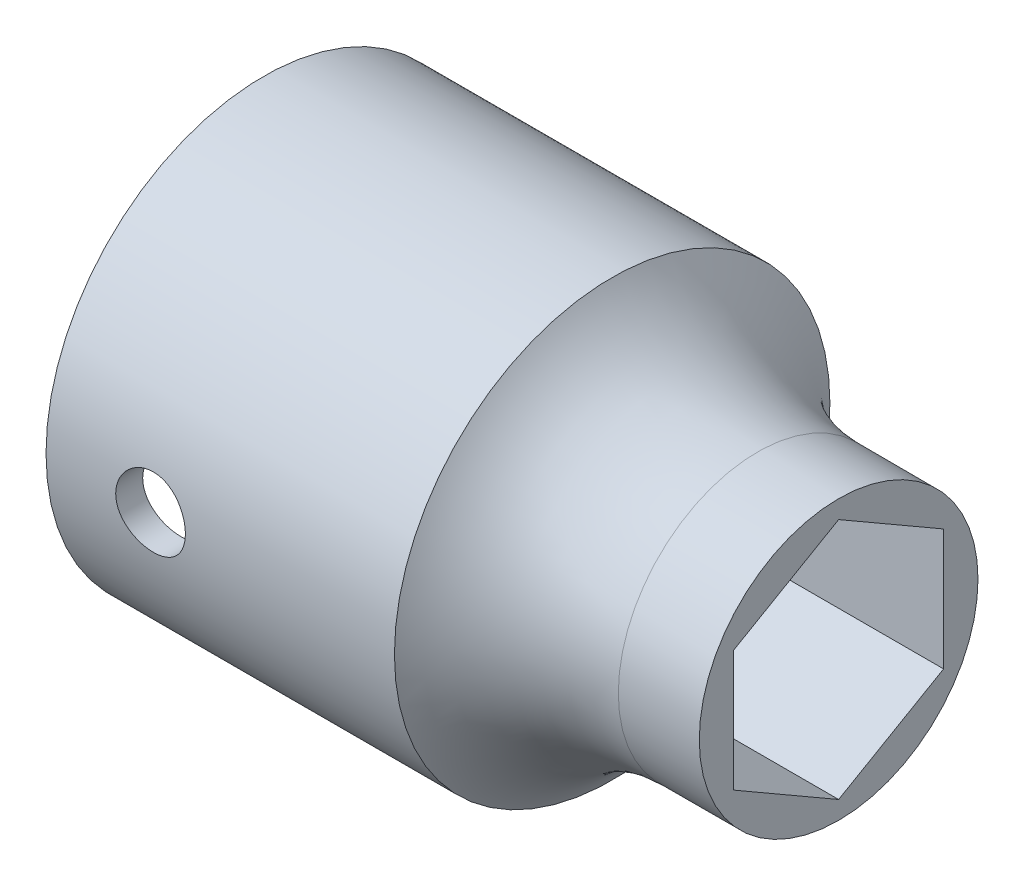
from build123d import *

# Parameters (mm, degrees)
CROQUIS1_R                 = 8
SALIENTE_EXTRUIR1_DEPTH    = 30
CORTAR_EXTRUIR1_DEPTH      = 8.5
CROQUIS9_R                 = 12.5
SALIENTE_EXTRUIR5_DEPTH    = 20
CROQUIS3_R                 = 10.95
CORTAR_EXTRUIR2_DEPTH      = 19
CORTAR_EXTRUIR3_REACH      = 27.952
CROQUIS4_R                 = 2.025
CORTAR_EXTRUIR4_DEPTH      = 35.820970693
CORTAR_EXTRUIR4_DEPTH_BACK = 35.820970693
CROQUIS5_R                 = 2
CROQUIS7_R                 = 8
SALIENTE_EXTRUIR3_DEPTH    = 3
REDONDEO1_R                = 10


with BuildPart() as part:
    # Croquis1 → Saliente-Extruir1 (new body)
    with BuildSketch(Plane(origin=(0, 0, 0), x_dir=(0, 0, -1), z_dir=(1, 0, 0))):
        Circle(CROQUIS1_R)
    extrude(amount=SALIENTE_EXTRUIR1_DEPTH)

    # Croquis2 → Cortar-Extruir1 (cut)
    with BuildSketch(Plane(origin=(30, 0, 0), x_dir=(0, 0, -1), z_dir=(1, 0, 0))):
        Polygon((0, -6.957070744), (6.025, -3.478535372), (6.025, 3.478535372), (0, 6.957070744), (-6.025, 3.478535372), (-6.025, -3.478535372), align=None)
    extrude(amount=-CORTAR_EXTRUIR1_DEPTH, mode=Mode.SUBTRACT)

    # Croquis9 → Saliente-Extruir5 (add)
    with BuildSketch(Plane.ZY):
        Circle(CROQUIS9_R)
    extrude(amount=-SALIENTE_EXTRUIR5_DEPTH)

    # Croquis3 → Cortar-Extruir2 (cut)
    with BuildSketch(Plane.ZY):
        Circle(CROQUIS3_R)
    extrude(amount=-CORTAR_EXTRUIR2_DEPTH, mode=Mode.SUBTRACT)

    # Croquis4 → Cortar-Extruir3 (cut, up to next)
    with BuildSketch(Plane.ZY.offset(-19), mode=Mode.PRIVATE) as cortar_extruir3_sk1:
        Circle(CROQUIS4_R)
    cortar_extruir3_tool1 = extrude(cortar_extruir3_sk1.sketch, amount=-CORTAR_EXTRUIR3_REACH, mode=Mode.PRIVATE) & part.part
    add(cortar_extruir3_tool1.solids().sort_by_distance((19, 0, 0))[0], mode=Mode.SUBTRACT)

    # Croquis5 → Cortar-Extruir4 (cut, two sides: drawn at the far end of the back side and taken through both)
    with BuildSketch(Plane.XY.offset(-CORTAR_EXTRUIR4_DEPTH_BACK)):
        with Locations((6, 0)):
            Circle(CROQUIS5_R)
    extrude(amount=CORTAR_EXTRUIR4_DEPTH + CORTAR_EXTRUIR4_DEPTH_BACK, mode=Mode.SUBTRACT)

    # Croquis7 → Saliente-Extruir3 (add)
    with BuildSketch(Plane(origin=(30, 0, 0), x_dir=(0, 0, -1), z_dir=(1, 0, 0))):
        with Locations(Location((0, 0, 0), (0, 0, 180))):
            Circle(CROQUIS7_R)
        Polygon((-6.025, -3.478535372), (0, -6.957070744), (6.025, -3.478535372), (6.025, 3.478535372), (0, 6.957070744), (-6.025, 3.478535372), align=None, mode=Mode.SUBTRACT)
    extrude(amount=SALIENTE_EXTRUIR3_DEPTH)

    # Redondeo1
    # the kernel refuses this fillet: 10 mm, written as the material it adds along each edge
    with BuildSketch(Plane(origin=(20, 0, 0), x_dir=(0, 0, -1), z_dir=(0, 1, 0))) as redondeo1_piece_1:
        with BuildLine():
            CenterArc((18, -8.351646544), REDONDEO1_R, 123.367012969, 56.632987031)
            Line((12.5, 0), (12.39, 0.167032931))
            ThreePointArc((12.39, 0.167032931), (10.25, 0.2), (8, 0.2))
            Line((8, 0.2), (7.8, 0))
            Line((7.8, 0), (7.8, -8.351646544))
            Line((7.8, -8.351646544), (8, -8.351646544))
        make_face()
    revolve(axis=Axis((20, 0, 0), (-1, 0, 0)))


solid = part.part
